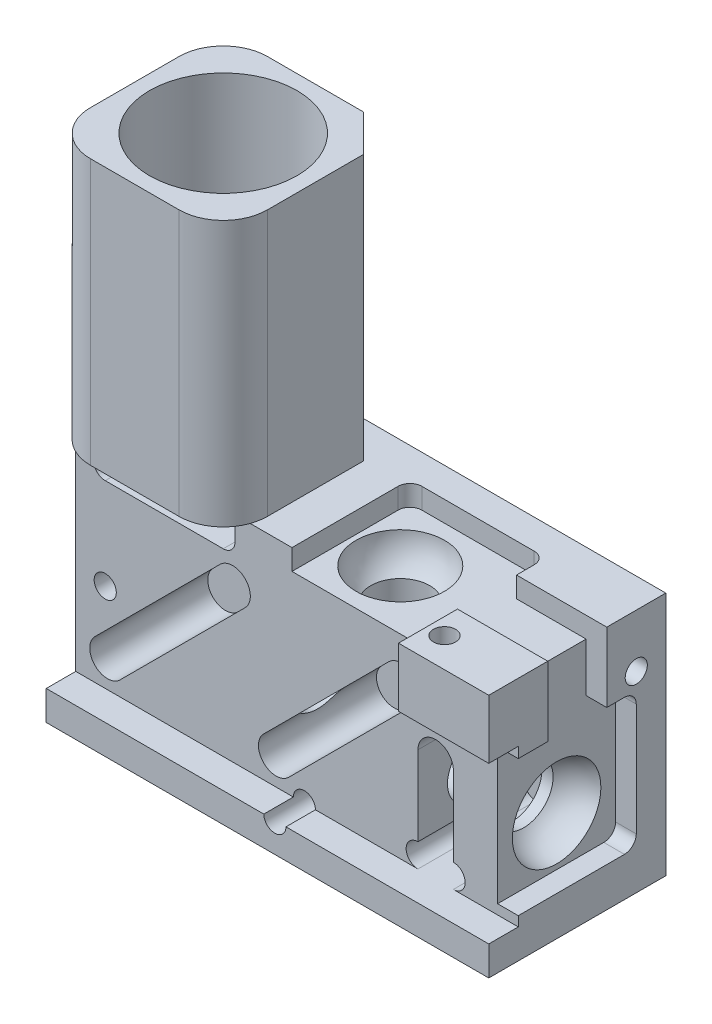
from build123d import *

# Parameters (mm, degrees)
SKETCH1_W                        = 15
SKETCH1_H                        = 6
MAIN_BODY_EXT_DEPTH              = 8.3
EMISSION_PATH_EXT_DEPTH          = 9
SKETCH3_R                        = 1.25
EMISSION_AND_GRIN_CUT_DEPTH      = 20.092931
SKETCH4_R                        = 1
DRUM_LENS_CUT_DEPTH              = 13
SKETCH41_R                       = 1
ADDTL_LIGHT_SOURCE_DEPTH         = 5
SKETCH5_W                        = 15
SKETCH5_H                        = 7.3
FILTERCOVER_CUT1_DEPTH           = 1
TOP_LED_SCREW_W                  = 3.06
TOP_LED_SCREW_H                  = 2
BOSS_EXTRUDE1_DEPTH              = 1
FILTERSET_CUT2_DEPTH             = 4
SKETCH10_R                       = 2.5
EMISSION_LENS_CUT_DEPTH          = 8.5
SKETCH15_R                       = 0.795
MAGNETS_CUT_DEPTH                = 0.9
SCREW_HOLES_CUT_DEPTH            = 20.507434
SCREW_HOLES_CUT_DEPTH_BACK       = 2.5
SKETCH18_R                       = 0.375
EXTERNAL_FILLET_1_R              = 1.5
VERTICAL_PATH_CUT_DEPTH          = 14.011149
VERTICAL_PATH_CUT_DEPTH_BACK     = 4
SKETCH28_R                       = 1.5
CUT_EXTRUDE_ORIGINAL_LIGHT_DEPTH = 0.7
CUT_EXTRUDE_ADDTL_LIGHT_DEPTH    = 0.7
SKETCH29_R                       = 0.375
SIDE_LED_SCREW_DEPTH             = 2.5
SKETCH32_W                       = 2
SKETCH32_H                       = 2.36
SIDE_WIRE_SLOT_CUT_DEPTH         = 0.7
SKETCH45_W                       = 2.36
SKETCH45_H                       = 2
TOP_LED_SLOT_DEPTH               = 0.7
CUT_EXTRUDE16_DEPTH              = 9
CUT_EXTRUDE17_REACH              = 13.945
SKETCH37_R                       = 2
SKETCH51_R                       = 0.375
TOP_LE_SCREW_DEPTH               = 2.1
NOTCH_EXTRUDE_DEPTH              = 2


with BuildPart() as part:
    # Sketch1 → Main Body Ext (new body)
    with BuildSketch(Plane(origin=(0, 0, 0), x_dir=(1, 0, 0), z_dir=(0, 1, 0))):
        Rectangle(SKETCH1_W, SKETCH1_H)
    extrude(amount=MAIN_BODY_EXT_DEPTH)

    # Sketch8 → Emission Path Ext (add)
    with BuildSketch(Plane(origin=(0, 8.3, 0), x_dir=(1, 0, 0), z_dir=(0, 1, 0))):
        Polygon((-2.75, 3), (-1.5, 1.75), (-1.5, -3), (-7.5, -3), (-7.5, 3), align=None)
    extrude(amount=EMISSION_PATH_EXT_DEPTH)

    # Sketch3 → Emission and Grin Cut (cut, through all)
    with BuildSketch(Plane.XZ):
        with Locations(Location((-4.5, 0, 0), (0, 0, 270))):
            Circle(SKETCH3_R)
    extrude(amount=-EMISSION_AND_GRIN_CUT_DEPTH, mode=Mode.SUBTRACT)

    # Sketch4 → Drum Lens Cut (cut)
    with BuildSketch(Plane(origin=(7.5, 0, 0), x_dir=(0, 0, -1), z_dir=(1, 0, 0))):
        with Locations((0, 3)):
            Circle(SKETCH4_R)
    extrude(amount=-DRUM_LENS_CUT_DEPTH, mode=Mode.SUBTRACT)

    # Sketch41 → Addtl Light Source (cut)
    with BuildSketch(Plane(origin=(0, 8.3, 0), x_dir=(1, 0, 0), z_dir=(0, 1, 0))):
        with Locations(Location((1.5, 0, 0), (0, 0, 270))):
            Circle(SKETCH41_R)
    extrude(amount=-ADDTL_LIGHT_SOURCE_DEPTH, mode=Mode.SUBTRACT)

    # Sketch5 → FilterCover Cut1 (cut)
    with BuildSketch(Plane.XY.offset(3)):
        with Locations((0, 4.65)):
            Rectangle(SKETCH5_W, SKETCH5_H)
    extrude(amount=-FILTERCOVER_CUT1_DEPTH, mode=Mode.SUBTRACT)

    # Top-LED-Screw → Boss-Extrude1 (add)
    with BuildSketch(Plane.XY.offset(2)):
        with Locations((5.97, 7.3)):
            Rectangle(TOP_LED_SCREW_W, TOP_LED_SCREW_H)
    extrude(amount=BOSS_EXTRUDE1_DEPTH)

    # Sketch6 → FilterSet Cut2 (cut)
    with BuildSketch(Plane.XY.offset(2)):
        with BuildLine():
            Line((5.3, 4.5), (5.3, 1.8))
            ThreePointArc((5.3, 1.8), (5.7, 1.4), (5.3, 1))
            Line((5.3, 1), (4.1, 1))
            ThreePointArc((4.1, 1), (3.7, 1.4), (4.1, 1.8))
            Line((4.1, 1.8), (4.1, 4.5))
            ThreePointArc((4.1, 4.5), (4.7, 5.1), (5.3, 4.5))
        make_face()
        with BuildLine():
            Line((-6.9, 7.9), (-6.9, 7.5))
            ThreePointArc((-6.9, 7.5), (-6.782843, 7.217157), (-6.5, 7.1))
            Line((-6.5, 7.1), (-2.5, 7.1))
            ThreePointArc((-2.5, 7.1), (-2.217157, 7.217157), (-2.1, 7.5))
            Line((-2.1, 7.5), (-2.1, 7.9))
            ThreePointArc((-2.1, 7.9), (-2.217157, 8.182843), (-2.5, 8.3))
            Line((-2.5, 8.3), (-6.5, 8.3))
            ThreePointArc((-6.5, 8.3), (-6.782843, 8.182843), (-6.9, 7.9))
        make_face()
        with BuildLine():
            Line((-2.605887, 6.591169), (-6.848528, 2.348528))
            ThreePointArc((-6.848528, 2.348528), (-6.848528, 1.5), (-6, 1.5))
            Line((-6, 1.5), (-1.757359, 5.742641))
            ThreePointArc((-1.757359, 5.742641), (-1.757359, 6.591169), (-2.605887, 6.591169))
        make_face()
        with BuildLine():
            Line((3.112092, 6.591169), (-1.130548, 2.348528))
            ThreePointArc((-1.130548, 2.348528), (-1.130548, 1.5), (-0.28202, 1.5))
            Line((-0.28202, 1.5), (3.96062, 5.742641))
            ThreePointArc((3.96062, 5.742641), (3.96062, 6.591169), (3.112092, 6.591169))
        make_face()
    extrude(amount=-FILTERSET_CUT2_DEPTH, mode=Mode.SUBTRACT)

    # Sketch10 → Emission Lens Cut (cut)
    with BuildSketch(Plane(origin=(0, 17.3, 0), x_dir=(1, 0, 0), z_dir=(0, 1, 0))):
        with Locations(Location((-4.5, 0, 0), (0, 0, 270))):
            Circle(SKETCH10_R)
    extrude(amount=-EMISSION_LENS_CUT_DEPTH, mode=Mode.SUBTRACT)

    # Sketch15 → Magnets Cut (cut)
    with BuildSketch(Plane.XZ):
        with Locations(Location((-6.25, -1.875, 0), (0, 0, 270))):
            Circle(SKETCH15_R)
        with Locations(Location((-6.25, 1.875, 0), (0, 0, 270))):
            Circle(SKETCH15_R)
        with Locations(Location((-1.5, 0, 0), (0, 0, 270))):
            Circle(SKETCH15_R)
    extrude(amount=-MAGNETS_CUT_DEPTH, mode=Mode.SUBTRACT)

    # Sketch18 → Screw Holes Cut (cut, two sides: drawn at the far end of the back side and taken through both)
    with BuildSketch(Plane.XY.offset(2).offset(-SCREW_HOLES_CUT_DEPTH_BACK)):
        with Locations(Location((-6.5, 4, 0), (0, 0, 180))):
            Circle(SKETCH18_R)
        with Locations(Location((6, 5.8, 0), (0, 0, 180))):
            Circle(SKETCH18_R)
        with Locations((0.25, 1)):
            Circle(SKETCH18_R)
    extrude(amount=SCREW_HOLES_CUT_DEPTH + SCREW_HOLES_CUT_DEPTH_BACK, mode=Mode.SUBTRACT)

    # External Fillet 1
    # the kernel refuses this fillet: 1.5 mm, written as the material it takes off along each edge
    with BuildSketch(Plane(origin=(-7.5, -3.75, -3), x_dir=(1, 0, 0), z_dir=(0, 1, 0))) as external_fillet_1_piece_1:
        with BuildLine():
            CenterArc((EXTERNAL_FILLET_1_R, -EXTERNAL_FILLET_1_R), EXTERNAL_FILLET_1_R, 90, 90)
            Line((0, -EXTERNAL_FILLET_1_R), (0, 0))
            Line((0, 0), (EXTERNAL_FILLET_1_R, 0))
        make_face()
    extrude(amount=24.8, mode=Mode.SUBTRACT)
    with BuildSketch(Plane(origin=(-1.5, 8.3, 3), x_dir=(0, 0, -1), z_dir=(0, 1, 0))) as external_fillet_1_piece_2:
        with BuildLine():
            CenterArc((EXTERNAL_FILLET_1_R, EXTERNAL_FILLET_1_R), EXTERNAL_FILLET_1_R, 180, 90)
            Line((0, EXTERNAL_FILLET_1_R), (0, 0))
            Line((0, 0), (EXTERNAL_FILLET_1_R, 0))
        make_face()
    extrude(amount=12.75, mode=Mode.SUBTRACT)

    # Sketch28 → Vertical-Path-Cut (cut, two sides: drawn at the far end of the back side and taken through both)
    with BuildSketch(Plane(origin=(0, 7.1, 0), x_dir=(1, 0, 0), z_dir=(0, 1, 0)).offset(-VERTICAL_PATH_CUT_DEPTH_BACK)):
        with Locations(Location((-4.5, 0, 0), (0, 0, 180))):
            Circle(SKETCH28_R)
    extrude(amount=VERTICAL_PATH_CUT_DEPTH + VERTICAL_PATH_CUT_DEPTH_BACK, mode=Mode.SUBTRACT)

    # Sketch12 → Cut-Extrude Original Light (cut)
    with BuildSketch(Plane(origin=(7.5, 0, 0), x_dir=(0, 0, -1), z_dir=(1, 0, 0))):
        with BuildLine():
            Line((1.6, 5.94), (-1.6, 5.94))
            Line((-1.6, 5.94), (-2, 5.94))
            Line((-2, 5.94), (-2, 1.33))
            Line((-2, 1.33), (1.6, 1.33))
            ThreePointArc((1.6, 1.33), (1.882843, 1.447157), (2, 1.73))
            Line((2, 1.73), (2, 5.54))
            ThreePointArc((2, 5.54), (1.882843, 5.822843), (1.6, 5.94))
        make_face()
    extrude(amount=-CUT_EXTRUDE_ORIGINAL_LIGHT_DEPTH, mode=Mode.SUBTRACT)

    # Sketch44 → Cut-Extrude Addtl Light (cut)
    with BuildSketch(Plane(origin=(0, 8.3, 0), x_dir=(1, 0, 0), z_dir=(0, 1, 0))):
        with BuildLine():
            Line((-0.17, -2), (4.44, -2))
            Line((4.44, -2), (4.44, 1.6))
            ThreePointArc((4.44, 1.6), (4.322843, 1.882843), (4.04, 2))
            Line((4.04, 2), (0.23, 2))
            ThreePointArc((0.23, 2), (-0.052843, 1.882843), (-0.17, 1.6))
            Line((-0.17, 1.6), (-0.17, -2))
        make_face()
    extrude(amount=-CUT_EXTRUDE_ADDTL_LIGHT_DEPTH, mode=Mode.SUBTRACT)

    # Sketch29 → Side-LED-Screw (cut)
    with BuildSketch(Plane(origin=(7.5, 0, 0), x_dir=(0, 0, -1), z_dir=(1, 0, 0))):
        with Locations((2, 6.5)):
            Circle(SKETCH29_R)
    extrude(amount=-SIDE_LED_SCREW_DEPTH, mode=Mode.SUBTRACT)

    # Sketch32 → Side-Wire-Slot-Cut (cut)
    with BuildSketch(Plane(origin=(7.5, 0, 0), x_dir=(0, 0, -1), z_dir=(1, 0, 0))):
        with Locations((0, 7.12)):
            Rectangle(SKETCH32_W, SKETCH32_H)
    extrude(amount=-SIDE_WIRE_SLOT_CUT_DEPTH, mode=Mode.SUBTRACT)

    # Sketch45 → Top-LED-slot (cut)
    with BuildSketch(Plane(origin=(0, 8.3, 0), x_dir=(1, 0, 0), z_dir=(0, 1, 0))):
        with Locations((5.62, 0)):
            Rectangle(SKETCH45_W, SKETCH45_H)
    extrude(amount=-TOP_LED_SLOT_DEPTH, mode=Mode.SUBTRACT)

    # Sketch33 → Side-BallLens_Cut (revolve, cut)
    with BuildSketch(Plane.XY, mode=Mode.PRIVATE) as side_balllens_cut_sk:
        with BuildLine():
            Line((6.8, 3), (5.3, 3))
            ThreePointArc((5.3, 3), (5.73934, 4.06066), (6.8, 4.5))
            Line((6.8, 4.5), (6.8, 3))
        make_face()
    revolve(side_balllens_cut_sk.sketch.rotate(Axis((6.8, 3, 0), (-1, 0, 0)), 84.26086), axis=Axis((6.8, 3, 0), (-1, 0, 0)), mode=Mode.SUBTRACT)

    # Sketch47 → Top-BallLens_Cut (revolve, cut)
    with BuildSketch(Plane(origin=(1.5, 0, 0), x_dir=(0, 0, -1), z_dir=(1, 0, 0))):
        with BuildLine():
            Line((-1.5, 7.6), (0, 7.6))
            Line((0, 7.6), (0, 6.137287))
            ThreePointArc((0, 6.137287), (-1.04756, 6.563498), (-1.5, 7.6))
        make_face()
    revolve(axis=Axis((1.5, 7.6, 0), (0, -1, 0)), mode=Mode.SUBTRACT)

    # Sketch36 → Cut-Extrude16 (cut)
    with BuildSketch(Plane(origin=(0, 17.3, 0), x_dir=(1, 0, 0), z_dir=(0, 1, 0))):
        with BuildLine():
            Line((-7.5, -1.5), (-7.5, -3))
            Line((-7.5, -3), (-6, -3))
            ThreePointArc((-6, -3), (-7.06066, -2.56066), (-7.5, -1.5))
        make_face()
    extrude(amount=-CUT_EXTRUDE16_DEPTH, mode=Mode.SUBTRACT)

    # Sketch37 → Cut-Extrude17 (cut, up to next)
    with BuildSketch(Plane(origin=(0, 8.8, 0), x_dir=(1, 0, 0), z_dir=(0, 1, 0)), mode=Mode.PRIVATE) as cut_extrude17_sk1:
        with Locations(Location((-4.5, 0, 0), (0, 0, 180))):
            Circle(SKETCH37_R)
    cut_extrude17_tool1 = extrude(cut_extrude17_sk1.sketch, amount=-CUT_EXTRUDE17_REACH, mode=Mode.PRIVATE) & part.part
    add(cut_extrude17_tool1.solids().sort_by_distance((-4.5, 8.8, 0))[0], mode=Mode.SUBTRACT)

    # Sketch51 → Top-LE-Screw (cut)
    with BuildSketch(Plane(origin=(0, 8.3, 0), x_dir=(1, 0, 0), z_dir=(0, 1, 0))):
        with Locations(Location((5, -2, 0), (0, 0, 270))):
            Circle(SKETCH51_R)
    extrude(amount=-TOP_LE_SCREW_DEPTH, mode=Mode.SUBTRACT)

    # Notch → Notch-Extrude (cut)
    with BuildSketch(Plane.XZ):
        Polygon((3.060555, -2.0476), (1.884933, -2.0476), (1.884933, -3), (4.489155, -3), align=None)
        Polygon((1.884933, -3), (1.884933, -2.0476), (1.25, -3), align=None)
    extrude(amount=-NOTCH_EXTRUDE_DEPTH, mode=Mode.SUBTRACT)


solid = part.part
